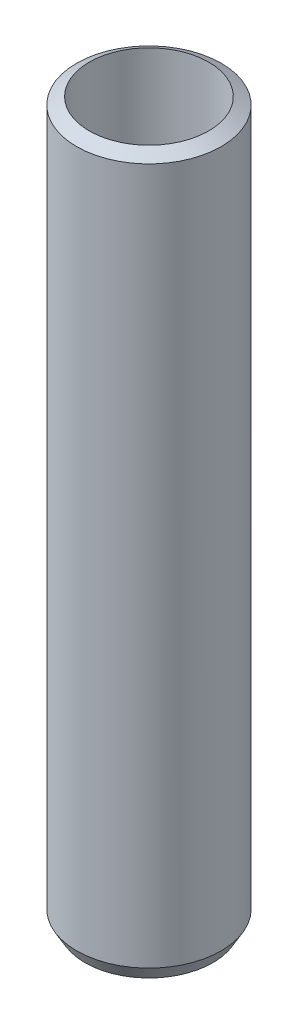
from build123d import *

# Parameters (mm, degrees)
SKETCH1_R           = 40
BOSS_EXTRUDE1_DEPTH = 398.088562
SKETCH2_R           = 33.033176467
CUT_EXTRUDE1_DEPTH  = 403.087680979
CHAMFER1_SIZE       = 4.62589
CHAMFER1_SIZE_2     = 8.012276


with BuildPart() as part:
    # Sketch1 → Boss-Extrude1 (new body)
    with BuildSketch(Plane(origin=(0, 0, 0), x_dir=(1, 0, 0), z_dir=(0, 1, 0))):
        with Locations(Location((0, 0, 0), (0, 0, 270))):
            Circle(SKETCH1_R)
    extrude(amount=BOSS_EXTRUDE1_DEPTH)

    # Sketch2 → Cut-Extrude1 (cut, through all)
    with BuildSketch(Plane(origin=(0, 0, 0), x_dir=(1, 0, 0), z_dir=(0, 1, 0))):
        with Locations(Location((0, 0, 0), (0, 0, 270))):
            Circle(SKETCH2_R)
    extrude(amount=CUT_EXTRUDE1_DEPTH, mode=Mode.SUBTRACT)

    # Chamfer1
    # the kernel refuses this chamfer: 8.012276, 4.62589 mm, written as the material it takes off along each edge
    with BuildSketch(Plane(origin=(0, 398.088562, 0), x_dir=(0, 0, 1), z_dir=(-1, 0, 0))) as chamfer1_piece_1:
        Polygon((40, -CHAMFER1_SIZE), (40 - CHAMFER1_SIZE_2, 0), (40, 0), align=None)
    revolve(axis=Axis((0, 398.088562, 0), (0, 1, 0)), mode=Mode.SUBTRACT)
    with BuildSketch(Plane(origin=(0, 0, 0), x_dir=(0, 0, 1), z_dir=(-1, 0, 0))) as chamfer1_piece_2:
        Polygon((40, CHAMFER1_SIZE_2), (40 - CHAMFER1_SIZE, 0), (40, 0), align=None)
    revolve(axis=Axis((0, 0, 0), (0, 1, 0)), mode=Mode.SUBTRACT)


solid = part.part
